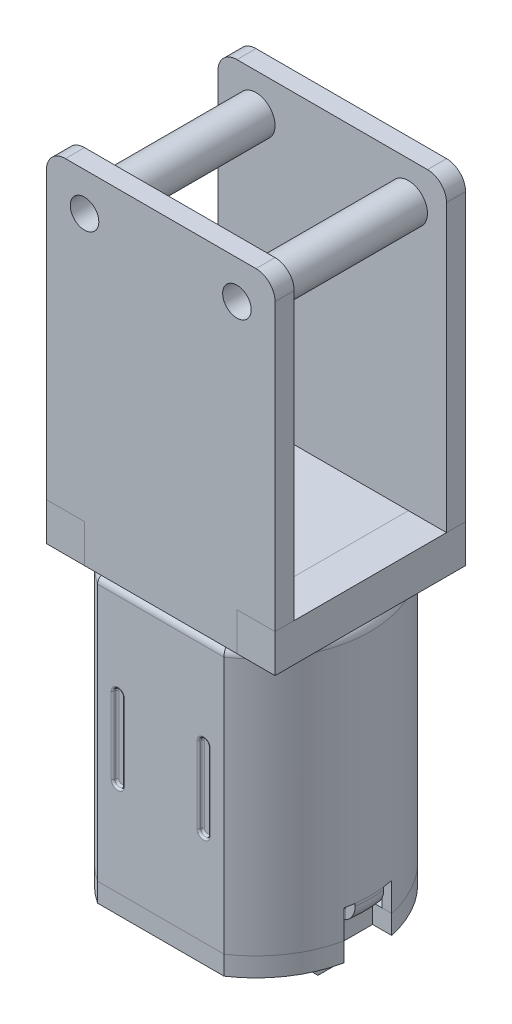
from build123d import *

# Parameters (mm, degrees)
EXTRUDE_1_DEPTH       = 14
CUT_EXTRUDE_1_DEPTH   = 13.5
SKETCH_4_W            = 1.5
SKETCH_4_H            = 0.5
CUT_EXTRUDE_2_DEPTH   = 1.5
EXTRUDE_3_DEPTH       = 1
SKETCH_6_W            = 1.5
SKETCH_6_H            = 0.5
EXTRUDE_5_DEPTH       = 1.5
SKETCH_6_W_2          = 1
SKETCH_6_H_2          = 2.5
EXTRUDE_5_2_DEPTH     = 1.5
EXTRUDE_5_3_DEPTH     = 1.5
SKETCH_7_W            = 1.5
SKETCH_7_H            = 2.5
EXTRUDE_6_DEPTH       = 1
EXTRUDE_9_DEPTH       = 1
EXTRUDE_9_2_DEPTH     = 1
EXTRUDE_11_REACH      = 21.286
EXTRUDE_11_END_RADIUS = 5.5
EXTRUDE_START         = 0.1
SKETCH_9_W            = 1.5
SKETCH_9_H            = 0.5
EXTRUDE_12_REACH      = 21.286
EXTRUDE_12_END_RADIUS = 5.5
SKETCH_10_W           = 1.5
SKETCH_10_H           = 0.5
FILLET_1_R            = 1
FILLET_2_R            = 1
CUT_EXTRUDE_3_DEPTH   = 0.2
CUT_EXTRUDE_START     = -0.2
CUT_EXTRUDE_4_DEPTH   = 0.2
FILLET_3_R            = 0.1
SKETCH_13_R           = 2.5
EXTRUDE_13_DEPTH      = 1
SKETCH_14_R           = 1
CUT_EXTRUDE_5_DEPTH   = 1
SKETCH_15_W           = 0.2
SKETCH_15_H           = 1.5
EXTRUDE_14_DEPTH      = 2
CHAMFER_1_SIZE        = 0.25
SKETCH_16_R           = 0.5
CUT_EXTRUDE_6_DEPTH   = 0.2
SKETCH_17_R           = 0.5
CUT_EXTRUDE_7_DEPTH   = 0.2
FILLET_4_R            = 0.5
SKETCH_18_W           = 2
SKETCH_18_H           = 10
EXTRUDE_15_DEPTH      = 2
EXTRUDE_16_DEPTH      = 10
SKETCH_20_W           = 8
SKETCH_20_H           = 16
CUT_EXTRUDE_8_DEPTH   = 23.203603388
SKETCH_21_R           = 1
EXTRUDE_17_DEPTH      = 8
SKETCH_22_R           = 0.75
CUT_EXTRUDE_9_DEPTH   = 22.447610664
SKETCH_23_R           = 2
EXTRUDE_18_DEPTH      = 0.5
SKETCH_24_R           = 1.5
CUT_EXTRUDE_10_DEPTH  = 0.5
FILLET_5_R            = 1


# Some blends are built 0.0001 mm under size
with BuildPart() as part:
    # 草图1 → 凸台-拉伸1 (new body)
    with BuildSketch(Plane(origin=(0, 0, 0), x_dir=(1, 0, 0), z_dir=(0, 1, 0))):
        with BuildLine():
            Line((-3.31662479, 5), (3.31662479, 5))
            ThreePointArc((3.31662479, 5), (6, 0), (3.31662479, -5))
            Line((3.31662479, -5), (-3.31662479, -5))
            ThreePointArc((-3.31662479, -5), (-6, 0), (-3.31662479, 5))
        make_face()
    extrude(amount=-EXTRUDE_1_DEPTH)

    # 草图3 → 切除-拉伸1 (cut)
    with BuildSketch(Plane.XZ.offset(14)):
        with BuildLine():
            Line((-3.16227766, 4.5), (3.16227766, 4.5))
            ThreePointArc((3.16227766, 4.5), (5.5, 0), (3.16227766, -4.5))
            Line((3.16227766, -4.5), (-3.16227766, -4.5))
            ThreePointArc((-3.16227766, -4.5), (-5.5, 0), (-3.16227766, 4.5))
        make_face()
    extrude(amount=-CUT_EXTRUDE_1_DEPTH, mode=Mode.SUBTRACT)

    # 草图4 → 切除-拉伸2 (cut)
    with BuildSketch(Plane.XZ.offset(14)):
        with BuildLine():
            Line((5.868347297, -1.25), (5.356071321, -1.25))
            ThreePointArc((5.356071321, -1.25), (5.5, 0), (5.356071321, 1.25))
            Line((5.356071321, 1.25), (5.868347297, 1.25))
            ThreePointArc((5.868347297, 1.25), (6, 0), (5.868347297, -1.25))
        make_face()
        with Locations((0, -4.75)):
            Rectangle(SKETCH_4_W, SKETCH_4_H)
        with BuildLine():
            Line((-5.868347297, 1.25), (-5.356071321, 1.25))
            ThreePointArc((-5.356071321, 1.25), (-5.5, 0), (-5.356071321, -1.25))
            Line((-5.356071321, -1.25), (-5.868347297, -1.25))
            ThreePointArc((-5.868347297, -1.25), (-6, 0), (-5.868347297, 1.25))
        make_face()
    extrude(amount=-CUT_EXTRUDE_2_DEPTH, mode=Mode.SUBTRACT)

    # 草图11 → 切除-拉伸3 (cut)
    with BuildSketch(Plane(origin=(0, 0, -5), x_dir=(-1, 0, 0), z_dir=(0, 0, -1))):
        with BuildLine():
            Line((-2, -5), (-2, -9))
            ThreePointArc((-2, -9), (-2.25, -9.25), (-2.5, -9))
            Line((-2.5, -9), (-2.5, -5))
            ThreePointArc((-2.5, -5), (-2.25, -4.75), (-2, -5))
        make_face()
        with BuildLine():
            Line((2, -5), (2, -9))
            ThreePointArc((2, -9), (2.25, -9.25), (2.5, -9))
            Line((2.5, -9), (2.5, -5))
            ThreePointArc((2.5, -5), (2.25, -4.75), (2, -5))
        make_face()
    extrude(amount=-CUT_EXTRUDE_3_DEPTH, mode=Mode.SUBTRACT)

    # 草图12 → 切除-拉伸4 (cut)
    with BuildSketch(Plane.XY.offset(5).offset(CUT_EXTRUDE_START)):
        with BuildLine():
            Line((-2, -5), (-2, -9))
            ThreePointArc((-2, -9), (-2.25, -9.25), (-2.5, -9))
            Line((-2.5, -9), (-2.5, -5))
            ThreePointArc((-2.5, -5), (-2.25, -4.75), (-2, -5))
        make_face()
        with BuildLine():
            Line((2, -5), (2, -9))
            ThreePointArc((2, -9), (2.25, -9.25), (2.5, -9))
            Line((2.5, -9), (2.5, -5))
            ThreePointArc((2.5, -5), (2.25, -4.75), (2, -5))
        make_face()
    extrude(amount=CUT_EXTRUDE_4_DEPTH, mode=Mode.SUBTRACT)

    # 圆角3
    fillet_3_edges = [part.edges().sort_by_distance(p)[0] for p in [
        (-2.25, -4.75, -4.8),
        (-2.5, -7, -4.8),
        (-2.25, -9.25, -4.8),
        (-2.25, -4.75, -5),
        (-2.5, -7, -5),
        (-2.25, -9.25, -5),
        (2.25, -4.75, -4.8),
        (2, -7, -4.8),
        (2.25, -9.25, -4.8),
        (2.25, -4.75, -5),
        (2, -7, -5),
        (2.25, -9.25, -5),
        (-2, -7, -4.8),
        (-2, -7, -5),
        (2.5, -7, -4.8),
        (2.5, -7, -5),
        (-2, -7, 5),
        (-2.25, -9.25, 5),
        (-2.5, -7, 5),
        (2.5, -7, 5),
        (2.25, -9.25, 5),
        (2, -7, 5),
        (2.5, -7, 4.8),
        (2.25, -9.25, 4.8),
        (2, -7, 4.8),
        (-2, -7, 4.8),
        (-2.25, -9.25, 4.8),
        (-2.5, -7, 4.8),
        (-2.25, -4.75, 5),
        (2.25, -4.75, 5),
        (2.25, -4.75, 4.8),
        (-2.25, -4.75, 4.8),
    ]]
    fillet(fillet_3_edges, radius=FILLET_3_R - 0.0001)  # a hair under: the kernel refuses the full size

    # 圆角4
    fillet_4_edges = [part.edges().sort_by_distance(p)[0] for p in [
        (0, 0, -5),
        (6, 0, 0),
        (0, 0, 5),
        (-6, 0, 0),
    ]]
    fillet(fillet_4_edges, radius=FILLET_4_R)

    # 草图18 → 凸台-拉伸15 (add)
    with BuildSketch(Plane(origin=(0, 0, 0), x_dir=(1, 0, 0), z_dir=(0, 1, 0))):
        with Locations((-5, 0)):
            Rectangle(SKETCH_18_W, SKETCH_18_H)
        with Locations((5, 0)):
            Rectangle(SKETCH_18_W, SKETCH_18_H)
    extrude(amount=EXTRUDE_15_DEPTH)


with BuildPart() as body_2:
    # 草图5 → 凸台-拉伸3 (new body)
    with BuildSketch(Plane.XZ.offset(14)):
        with BuildLine():
            Line((-3.31662479, 5), (3.31662479, 5))
            ThreePointArc((3.31662479, 5), (4.960499275, 3.375418039), (5.868347297, 1.25))
            Line((5.868347297, 1.25), (4.868347297, 1.25))
            Line((4.868347297, 1.25), (4.868347297, -1.25))
            Line((4.868347297, -1.25), (5.868347297, -1.25))
            ThreePointArc((5.868347297, -1.25), (4.960499275, -3.375418039), (3.31662479, -5))
            Line((3.31662479, -5), (-3.31662479, -5))
            ThreePointArc((-3.31662479, -5), (-4.960499275, -3.375418039), (-5.868347297, -1.25))
            Line((-5.868347297, -1.25), (-4.868347297, -1.25))
            Line((-4.868347297, -1.25), (-4.868347297, 1.25))
            Line((-4.868347297, 1.25), (-5.868347297, 1.25))
            ThreePointArc((-5.868347297, 1.25), (-4.960499275, 3.375418039), (-3.31662479, 5))
        make_face()
    extrude(amount=EXTRUDE_3_DEPTH)

    # 草图13 → 凸台-拉伸13 (add)
    with BuildSketch(Plane.XZ.offset(15)):
        with Locations(Location((0, 0, 0), (0, 0, 270))):
            Circle(SKETCH_13_R)
    extrude(amount=EXTRUDE_13_DEPTH)

    # 草图14 → 切除-拉伸5 (cut)
    with BuildSketch(Plane.XZ.offset(16)):
        with Locations(Location((0, 0, 0), (0, 0, 270))):
            Circle(SKETCH_14_R)
    extrude(amount=-CUT_EXTRUDE_5_DEPTH, mode=Mode.SUBTRACT)

    # 草图15 → 凸台-拉伸14 (add)
    with BuildSketch(Plane.XZ.offset(15)):
        with Locations((-3.65, 0)):
            Rectangle(SKETCH_15_W, SKETCH_15_H)
        with Locations((3.65, 0)):
            Rectangle(SKETCH_15_W, SKETCH_15_H)
    extrude(amount=EXTRUDE_14_DEPTH)

    # 倒角1
    chamfer_1_edges = [body_2.edges().sort_by_distance(p)[0] for p in [
        (-3.65, -17, -0.75),
        (-3.65, -17, 0.75),
        (3.65, -17, 0.75),
        (3.65, -17, -0.75),
    ]]
    chamfer(chamfer_1_edges, length=CHAMFER_1_SIZE)

    # 草图16 → 切除-拉伸6 (cut)
    with BuildSketch(Plane.ZY.offset(3.75)):
        with Locations((0, -16.25)):
            Circle(SKETCH_16_R)
    extrude(amount=-CUT_EXTRUDE_6_DEPTH, mode=Mode.SUBTRACT)

    # 草图17 → 切除-拉伸7 (cut)
    with BuildSketch(Plane(origin=(3.75, 0, 0), x_dir=(0, 0, -1), z_dir=(1, 0, 0))):
        with Locations(Location((0, -16.25, 0), (0, 0, 180))):
            Circle(SKETCH_17_R)
    extrude(amount=-CUT_EXTRUDE_7_DEPTH, mode=Mode.SUBTRACT)


with BuildPart() as body_3:
    # 草图6 → 凸台-拉伸5 (new body)
    with BuildSketch(Plane(origin=(0, -14, 0), x_dir=(1, 0, 0), z_dir=(0, 1, 0))):
        with Locations((0, 4.75)):
            Rectangle(SKETCH_6_W, SKETCH_6_H)
    extrude(amount=EXTRUDE_5_DEPTH)


with BuildPart() as body_4:
    # 草图6 → Extrude 5 2 (new body)
    with BuildSketch(Plane(origin=(0, -14, 0), x_dir=(1, 0, 0), z_dir=(0, 1, 0))):
        with Locations((4.368347297, 0)):
            Rectangle(SKETCH_6_W_2, SKETCH_6_H_2)
    extrude(amount=EXTRUDE_5_2_DEPTH)



with BuildPart() as body_5:
    # 草图6 → Extrude 5 3 (new body)
    with BuildSketch(Plane(origin=(0, -14, 0), x_dir=(1, 0, 0), z_dir=(0, 1, 0))):
        with Locations((-4.368347297, 0)):
            Rectangle(SKETCH_6_W_2, SKETCH_6_H_2)
    extrude(amount=EXTRUDE_5_3_DEPTH)


with BuildPart() as body_4_1:
    add(body_4.part)

    add(body_5.part)  # 凸台-拉伸6 merges body 5
    # 草图7 → 凸台-拉伸6 (add)
    with BuildSketch(Plane(origin=(0, -12.5, 0), x_dir=(1, 0, 0), z_dir=(0, 1, 0))):
        with Locations((-4.618347297, 0)):
            Rectangle(SKETCH_7_W, SKETCH_7_H)
        with Locations((4.618347297, 0)):
            Rectangle(SKETCH_7_W, SKETCH_7_H)
    extrude(amount=EXTRUDE_6_DEPTH)


with BuildPart() as body_5_2:
    # 草图8 → 凸台-拉伸9 (new body)
    with BuildSketch(Plane.XZ.offset(12.5)):
        with BuildLine():
            Line((-5.95294045, 0.75), (-5.448623679, 0.75))
            ThreePointArc((-5.448623679, 0.75), (-5.5, 0), (-5.448623679, -0.75))
            Line((-5.448623679, -0.75), (-5.95294045, -0.75))
            ThreePointArc((-5.95294045, -0.75), (-6, 0), (-5.95294045, 0.75))
        make_face()
    extrude(amount=EXTRUDE_9_DEPTH)

    # 圆角1
    # the kernel refuses this fillet: 1 mm, written as the material it takes off along each edge
    with BuildSketch(Plane(origin=(0, -13.5, 0), x_dir=(-0.8841263383961817, 0, -0.4672479189404275), z_dir=(0.4672479189404275, 0, -0.8841263383961817))) as fillet_1_piece_1:
        with BuildLine():
            CenterArc((5, 0.866025404), FILLET_1_R, 300, 60)
            Line((5.5, 0), (5.51, -0.017320508))
            ThreePointArc((5.51, -0.017320508), (5.75, -0.02), (6, -0.02))
            Line((6, -0.02), (6.02, 0))
            Line((6.02, 0), (6.02, 0.866025404))
            Line((6.02, 0.866025404), (6, 0.866025404))
        make_face()
    revolve(axis=Axis((0, -13.5, 0), (0, 1, 0)), revolution_arc=55.711601562, mode=Mode.SUBTRACT)


with BuildPart() as body_6:
    # 草图8 → Extrude 9 2 (new body)
    with BuildSketch(Plane.XZ.offset(12.5)):
        with BuildLine():
            Line((5.95294045, 0.75), (5.448623679, 0.75))
            ThreePointArc((5.448623679, 0.75), (5.5, 0), (5.448623679, -0.75))
            Line((5.448623679, -0.75), (5.95294045, -0.75))
            ThreePointArc((5.95294045, -0.75), (6, 0), (5.95294045, 0.75))
        make_face()
    extrude(amount=EXTRUDE_9_2_DEPTH)

    # 圆角2
    # the kernel refuses this fillet: 1 mm, written as the material it takes off along each edge
    with BuildSketch(Plane(origin=(0, -13.5, 0), x_dir=(0.8841263383961846, 0, -0.4672479189404221), z_dir=(-0.4672479189404221, 0, -0.8841263383961846))) as fillet_2_piece_1:
        with BuildLine():
            CenterArc((5, -0.866025404), FILLET_2_R, 0, 60)
            Line((5.5, 0), (5.51, 0.017320508))
            ThreePointArc((5.51, 0.017320508), (5.75, 0.02), (6, 0.02))
            Line((6, 0.02), (6.02, 0))
            Line((6.02, 0), (6.02, -0.866025404))
            Line((6.02, -0.866025404), (6, -0.866025404))
        make_face()
    revolve(axis=Axis((0, -13.5, 0), (0, -1, 0)), revolution_arc=55.711601562, mode=Mode.SUBTRACT)


with BuildPart() as body_7:
    # 凸台-拉伸11: up to this cylinder (the profile starts inside it)
    extrude_11_end = Plane(origin=(0, -13.25, 0), z_dir=(0, 1, 0)) * Cylinder(EXTRUDE_11_END_RADIUS, 54.572, mode=Mode.PRIVATE)
    # 草图9 → 凸台-拉伸11 (new, up to the surface)
    with BuildSketch(Plane.ZY.offset(4.868347297).offset(EXTRUDE_START), mode=Mode.PRIVATE) as extrude_11_sk1:
        with Locations((0, -13.25)):
            Rectangle(SKETCH_9_W, SKETCH_9_H)
    extrude_11_tool1 = extrude(extrude_11_sk1.sketch, amount=EXTRUDE_11_REACH, mode=Mode.PRIVATE) & extrude_11_end
    add(extrude_11_tool1.solids().sort_by_distance((-4.968347, -13.25, 0))[0])


with BuildPart() as body_8:
    # 凸台-拉伸12: up to this cylinder (the profile starts inside it)
    extrude_12_end = Plane(origin=(0, -13.25, 0), z_dir=(0, 1, 0)) * Cylinder(EXTRUDE_12_END_RADIUS, 54.572, mode=Mode.PRIVATE)
    # 草图10 → 凸台-拉伸12 (new, up to the surface)
    with BuildSketch(Plane(origin=(4.868347297, 0, 0), x_dir=(0, 0, -1), z_dir=(1, 0, 0)).offset(EXTRUDE_START), mode=Mode.PRIVATE) as extrude_12_sk1:
        with Locations((0, -13.25)):
            Rectangle(SKETCH_10_W, SKETCH_10_H)
    extrude_12_tool1 = extrude(extrude_12_sk1.sketch, amount=EXTRUDE_12_REACH, mode=Mode.PRIVATE) & extrude_12_end
    add(extrude_12_tool1.solids().sort_by_distance((4.968347, -13.25, 0))[0])


with BuildPart() as body_9:
    # 草图19 → 凸台-拉伸16 (new body)
    with BuildSketch(Plane(origin=(0, 0, -5), x_dir=(-1, 0, 0), z_dir=(0, 0, -1))):
        Polygon((-6, 2), (-4, 2), (-4, 0), (4, 0), (4, 2), (6, 2), (6, 18), (-6, 18), align=None)
    extrude(amount=-EXTRUDE_16_DEPTH)

    # 草图20 → 切除-拉伸8 (cut, through all)
    with BuildSketch(Plane(origin=(6, 0, 0), x_dir=(0, 0, -1), z_dir=(1, 0, 0))):
        with Locations((0, 10)):
            Rectangle(SKETCH_20_W, SKETCH_20_H)
    extrude(amount=-CUT_EXTRUDE_8_DEPTH, mode=Mode.SUBTRACT)

    # 草图21 → 凸台-拉伸17 (add)
    with BuildSketch(Plane(origin=(0, 0, 4), x_dir=(-1, 0, 0), z_dir=(0, 0, -1))):
        with Locations(Location((-4, 16, 0), (0, 0, 270))):
            Circle(SKETCH_21_R)
        with Locations(Location((4, 16, 0), (0, 0, 270))):
            Circle(SKETCH_21_R)
    extrude(amount=EXTRUDE_17_DEPTH)

    # 草图22 → 切除-拉伸9 (cut, through all)
    with BuildSketch(Plane(origin=(0, 0, -5), x_dir=(-1, 0, 0), z_dir=(0, 0, -1))):
        with Locations((-4, 16)):
            Circle(SKETCH_22_R)
        with Locations(Location((4, 16, 0), (0, 0, 180))):
            Circle(SKETCH_22_R)
    extrude(amount=-CUT_EXTRUDE_9_DEPTH, mode=Mode.SUBTRACT)

    # 草图23 → 凸台-拉伸18 (add)
    with BuildSketch(Plane(origin=(0, 0, -5), x_dir=(-1, 0, 0), z_dir=(0, 0, -1))):
        with Locations((0, 14)):
            Circle(SKETCH_23_R)
    extrude(amount=EXTRUDE_18_DEPTH)

    # 草图24 → 切除-拉伸10 (cut)
    with BuildSketch(Plane(origin=(0, 0, -5.5), x_dir=(-1, 0, 0), z_dir=(0, 0, -1))):
        with Locations((0, 14)):
            Circle(SKETCH_24_R)
    extrude(amount=-CUT_EXTRUDE_10_DEPTH, mode=Mode.SUBTRACT)

    # 圆角5
    fillet_5_edges = [body_9.edges().sort_by_distance(p)[0] for p in [
        (-6, 18, 4.5),
        (6, 18, 4.5),
        (-6, 18, -4.5),
        (6, 18, -4.5),
    ]]
    fillet(fillet_5_edges, radius=FILLET_5_R)


solid = Compound([part.part, body_2.part, body_3.part, body_4_1.part, body_5_2.part, body_6.part, body_7.part, body_8.part, body_9.part])
